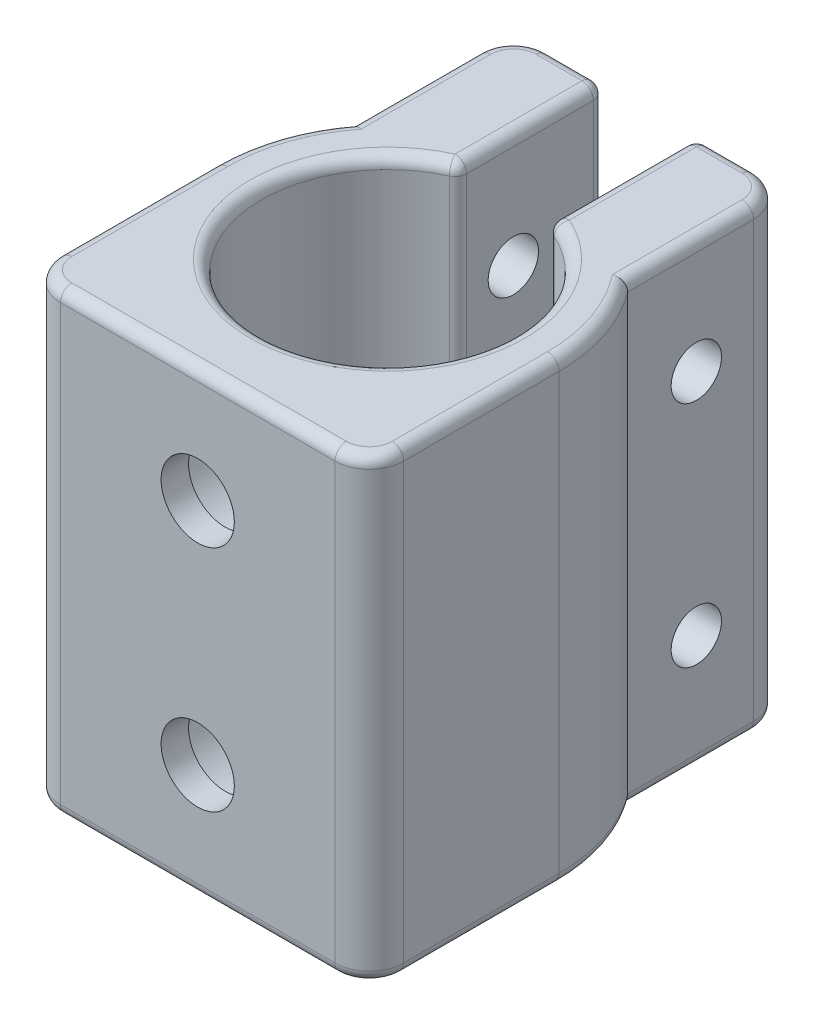
from build123d import *

# Parameters (mm, degrees)
BOSS_EXTRUDE1_DEPTH                          = 20
M3_START                                     = 5.262128746
M3_CLEARANCE_HOLE1_OUTLINE_R                 = 1.6
M3_CLEARANCE_HOLE1_DEPTH                     = 3.034503848
CBORE_START                                  = -6
CBORE_FOR_M2_PAN_HEAD_MACHINE_SCREW6_OUT_R   = 1.1
CBORE_FOR_M2_PAN_HEAD_MACHINE_SCREW6_DEPTH   = 12
CBORE_FOR_M2_PAN_HEAD_MACHINE_SCREW6_2_O_R   = 2.5
CBORE_FOR_M2_PAN_HEAD_MACHINE_SCREW6_2_O_R_2 = 1.1
CBORE_FOR_M2_PAN_HEAD_MACHINE_SCREW6_2_DEPTH = 0.1
CUT_EXTRUDE4_START                           = -1.2
SKETCH10_R                                   = 2.8
CUT_EXTRUDE4_DEPTH                           = 3
FILLET2_R                                    = 1.5
FILLET3_R                                    = 0.5


# Read off the part's stored shape, not the designer's step: M3 Clearance Hole1, CBORE for M2 Pan Head Machine Screw6
with BuildPart() as part:
    # Sketch2 → Boss-Extrude1 (new body)
    with BuildSketch(Plane(origin=(0, 0, 0), x_dir=(1, 0, 0), z_dir=(0, 1, 0))):
        with BuildLine():
            Line((-2, 11.5), (-6, 11.5))
            Line((-6, 11.5), (-6, 4.5))
            ThreePointArc((-6, 4.5), (-4.226235165, 6.195880594), (-2, 7.228416147))
            Line((-2, 7.228416147), (-2, 11.5))
        make_face()
        with BuildLine():
            Line((6, 11.5), (2, 11.5))
            Line((2, 11.5), (2, 7.228416147))
            ThreePointArc((2, 7.228416147), (4.226235165, 6.195880594), (6, 4.5))
            Line((6, 4.5), (6, 11.5))
        make_face()
        with BuildLine():
            ThreePointArc((6, 4.5), (4.226235165, 6.195880594), (2, 7.228416147))
            Line((2, 7.228416147), (2, 5.123475383))
            ThreePointArc((2, 5.123475383), (3.335664101, 4.373024698), (4.412505498, 3.283259849))
            Line((4.412505498, 3.283259849), (6, 3.283259849))
            Line((6, 3.283259849), (6, 4.5))
        make_face()
        with BuildLine():
            Line((-6, 3.283259849), (-6, 4.5))
            ThreePointArc((-6, 4.5), (-7.115124735, 2.371708245), (-7.5, 0))
            ThreePointArc((-7.5, 0), (0, -7.5), (7.5, 0))
            ThreePointArc((7.5, 0), (7.115124735, 2.371708245), (6, 4.5))
            Line((6, 4.5), (6, 3.283259849))
            Line((6, 3.283259849), (4.412505498, 3.283259849))
            ThreePointArc((4.412505498, 3.283259849), (5.221052587, 1.729337989), (5.5, 0))
            ThreePointArc((5.5, 0), (-1.729337989, -5.221052587), (-4.412505498, 3.283259849))
            Line((-4.412505498, 3.283259849), (-6, 3.283259849))
        make_face()
        with BuildLine():
            ThreePointArc((7.5, 0), (0, -7.5), (-7.5, 0))
            Line((-7.5, 0), (-7.5, -8.296632594))
            Line((-7.5, -8.296632594), (7.5, -8.296632594))
            Line((7.5, -8.296632594), (7.5, 0))
        make_face()
        with BuildLine():
            ThreePointArc((-2, 7.228416147), (-4.226235165, 6.195880594), (-6, 4.5))
            Line((-6, 4.5), (-6, 3.283259849))
            Line((-6, 3.283259849), (-4.412505498, 3.283259849))
            ThreePointArc((-4.412505498, 3.283259849), (-3.335664101, 4.373024698), (-2, 5.123475383))
            Line((-2, 5.123475383), (-2, 7.228416147))
        make_face()
    extrude(amount=BOSS_EXTRUDE1_DEPTH)

    # M3 Clearance Hole1 outline → M3 Clearance Hole1 (cut)
    with BuildSketch(Plane.XY.offset(M3_START)):
        with Locations((0, 5)):
            Circle(M3_CLEARANCE_HOLE1_OUTLINE_R)
        with Locations((0, 15)):
            Circle(M3_CLEARANCE_HOLE1_OUTLINE_R)
    extrude(amount=M3_CLEARANCE_HOLE1_DEPTH, mode=Mode.SUBTRACT)

    # CBORE for M2 Pan Head Machine Screw6 out → CBORE for M2 Pan Head Machine Screw6 (cut)
    with BuildSketch(Plane.YZ.offset(CBORE_START)):
        with Locations((5, -7.5)):
            Circle(CBORE_FOR_M2_PAN_HEAD_MACHINE_SCREW6_OUT_R)
        with Locations((15, -7.5)):
            Circle(CBORE_FOR_M2_PAN_HEAD_MACHINE_SCREW6_OUT_R)
    extrude(amount=CBORE_FOR_M2_PAN_HEAD_MACHINE_SCREW6_DEPTH, mode=Mode.SUBTRACT)

    # CBORE for M2 Pan Head Machine Screw6 2 o → CBORE for M2 Pan Head Machine Screw6 2 (cut)
    # profile 1 of 2: a face of its own
    with BuildSketch(Plane.YZ.offset(CBORE_START)):
        with Locations((5, -7.5)):
            Circle(CBORE_FOR_M2_PAN_HEAD_MACHINE_SCREW6_2_O_R)
        with Locations((5, -7.5)):
            Circle(CBORE_FOR_M2_PAN_HEAD_MACHINE_SCREW6_2_O_R_2, mode=Mode.SUBTRACT)
    # profile 2 of 2: a face of its own
    with BuildSketch(Plane.YZ.offset(CBORE_START)):
        with Locations((15, -7.5)):
            Circle(CBORE_FOR_M2_PAN_HEAD_MACHINE_SCREW6_2_O_R)
        with Locations((15, -7.5)):
            Circle(CBORE_FOR_M2_PAN_HEAD_MACHINE_SCREW6_2_O_R_2, mode=Mode.SUBTRACT)
    extrude(amount=CBORE_FOR_M2_PAN_HEAD_MACHINE_SCREW6_2_DEPTH, mode=Mode.SUBTRACT)

    # Sketch10 → Cut-Extrude4 (cut)
    with BuildSketch(Plane.XY.offset(8.296632594).offset(CUT_EXTRUDE4_START)):
        with Locations((0, 15)):
            Circle(SKETCH10_R)
        with Locations((0, 5)):
            Circle(SKETCH10_R)
    extrude(amount=-CUT_EXTRUDE4_DEPTH, mode=Mode.SUBTRACT)

    # Fillet2
    fillet2_edges = [part.edges().sort_by_distance(p)[0] for p in [
        (-6, 10, -11.5),
        (6, 10, -11.5),
        (7.5, 10, 8.296632594),
        (-7.5, 10, 8.296632594),
    ]]
    fillet(fillet2_edges, radius=FILLET2_R - 0.0001)  # a hair under: the kernel refuses the full size

    # Fillet3
    fillet3_edges = [part.edges().sort_by_distance(p)[0] for p in [
        (0, 0, 8.296632594),
        (-7.060689461, 0, 7.857322055),
        (7.060689461, 0, 7.857322055),
        (5.560689461, 0, -11.060689461),
        (-5.560689461, 0, -11.060689461),
        (-3.25005, 20, -11.5),
        (0, 20, 8.296632594),
        (7.5, 20, 3.398366297),
        (6, 20, -7.25005),
        (-7.060689461, 20, 7.857322055),
        (-7.115124735, 20, -2.371708245),
        (7.060689461, 20, 7.857322055),
        (5.560689461, 20, -11.060689461),
        (-5.560689461, 20, -11.060689461),
        (-2, 0, -8.311737691),
        (1.517117002, 0, 5.286620471),
        (-7.5, 20, 3.398366297),
        (2, 0, -8.311737691),
        (3.25005, 0, -11.5),
        (7.115124735, 0, -2.371708245),
        (-7.5, 0, 3.398366297),
        (-7.115124735, 0, -2.371708245),
        (-2, 10, -11.5),
        (-2, 10, -5.123475383),
        (2, 10, -5.123475383),
        (2, 10, -11.5),
        (7.115124735, 20, -2.371708245),
        (3.25005, 20, -11.5),
        (2, 20, -8.311737691),
        (1.517117002, 20, 5.286620471),
        (-2, 20, -8.311737691),
        (-6, 0, -7.25005),
        (-6, 20, -7.25005),
        (-3.25005, 0, -11.5),
        (6, 0, -7.25005),
        (7.5, 0, 3.398366297),
    ]]
    fillet(fillet3_edges, radius=FILLET3_R)


solid = part.part
